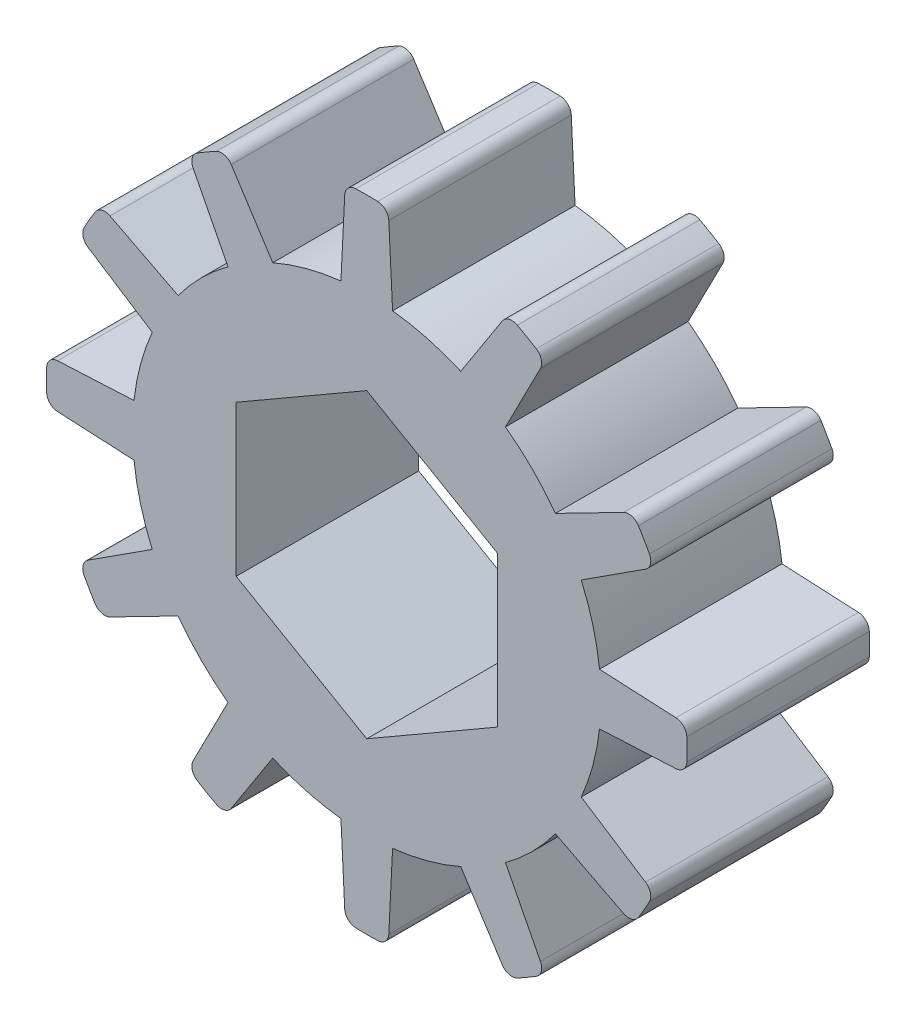
from build123d import *

# Parameters (mm, degrees)
CROQUIS1_R              = 0.5
SALIENTE_EXTRUIR1_DEPTH = 3.18
CORTAR_EXTRUIR3_DEPTH   = 9.508591314
REDONDEO1_R             = 0.2


with BuildPart() as part:
    # Croquis1 → Saliente-Extruir1 (new body)
    with BuildSketch(Plane.XY):
        with BuildLine():
            Line((0.375, 5.567875544), (0.45, 4.055600396))
            ThreePointArc((0.45, 4.055600396), (1.056108396, 3.941450193), (1.638088766, 3.737252971))
            Line((1.638088766, 3.737252971), (2.459178246, 5.009421667))
            ThreePointArc((2.459178246, 5.009421667), (2.790244751, 4.832845674), (3.108697299, 4.634421667))
            Line((3.108697299, 4.634421667), (2.41751163, 3.287252971))
            ThreePointArc((2.41751163, 3.287252971), (2.885341797, 2.885341797), (3.287252971, 2.41751163))
            Line((3.287252971, 2.41751163), (4.634421667, 3.108697299))
            ThreePointArc((4.634421667, 3.108697299), (4.832845674, 2.790244751), (5.009421667, 2.459178246))
            Line((5.009421667, 2.459178246), (3.737252971, 1.638088766))
            ThreePointArc((3.737252971, 1.638088766), (3.941450193, 1.056108396), (4.055600396, 0.45))
            Line((4.055600396, 0.45), (5.567875544, 0.375))
            ThreePointArc((5.567875544, 0.375), (5.580489502, 0), (5.567875544, -0.375))
            Line((5.567875544, -0.375), (4.055600396, -0.45))
            ThreePointArc((4.055600396, -0.45), (3.941450193, -1.056108396), (3.737252971, -1.638088766))
            Line((3.737252971, -1.638088766), (5.009421667, -2.459178246))
            ThreePointArc((5.009421667, -2.459178246), (4.832845674, -2.790244751), (4.634421667, -3.108697299))
            Line((4.634421667, -3.108697299), (3.287252971, -2.41751163))
            ThreePointArc((3.287252971, -2.41751163), (2.885341797, -2.885341797), (2.41751163, -3.287252971))
            Line((2.41751163, -3.287252971), (3.108697299, -4.634421667))
            ThreePointArc((3.108697299, -4.634421667), (2.790244751, -4.832845674), (2.459178246, -5.009421667))
            Line((2.459178246, -5.009421667), (1.638088766, -3.737252971))
            ThreePointArc((1.638088766, -3.737252971), (1.056108396, -3.941450193), (0.45, -4.055600396))
            Line((0.45, -4.055600396), (0.375, -5.567875544))
            ThreePointArc((0.375, -5.567875544), (0, -5.580489502), (-0.375, -5.567875544))
            Line((-0.375, -5.567875544), (-0.45, -4.055600396))
            ThreePointArc((-0.45, -4.055600396), (-1.056108396, -3.941450193), (-1.638088766, -3.737252971))
            Line((-1.638088766, -3.737252971), (-2.459178246, -5.009421667))
            ThreePointArc((-2.459178246, -5.009421667), (-2.790244751, -4.832845674), (-3.108697299, -4.634421667))
            Line((-3.108697299, -4.634421667), (-2.41751163, -3.287252971))
            ThreePointArc((-2.41751163, -3.287252971), (-2.885341797, -2.885341797), (-3.287252971, -2.41751163))
            Line((-3.287252971, -2.41751163), (-4.634421667, -3.108697299))
            ThreePointArc((-4.634421667, -3.108697299), (-4.832845674, -2.790244751), (-5.009421667, -2.459178246))
            Line((-5.009421667, -2.459178246), (-3.737252971, -1.638088766))
            ThreePointArc((-3.737252971, -1.638088766), (-3.941450193, -1.056108396), (-4.055600396, -0.45))
            Line((-4.055600396, -0.45), (-5.567875544, -0.375))
            ThreePointArc((-5.567875544, -0.375), (-5.580489502, 0), (-5.567875544, 0.375))
            Line((-5.567875544, 0.375), (-4.055600396, 0.45))
            ThreePointArc((-4.055600396, 0.45), (-3.941450193, 1.056108396), (-3.737252971, 1.638088766))
            Line((-3.737252971, 1.638088766), (-5.009421667, 2.459178246))
            ThreePointArc((-5.009421667, 2.459178246), (-4.832845674, 2.790244751), (-4.634421667, 3.108697299))
            Line((-4.634421667, 3.108697299), (-3.287252971, 2.41751163))
            ThreePointArc((-3.287252971, 2.41751163), (-2.885341797, 2.885341797), (-2.41751163, 3.287252971))
            Line((-2.41751163, 3.287252971), (-3.108697299, 4.634421667))
            ThreePointArc((-3.108697299, 4.634421667), (-2.790244751, 4.832845674), (-2.459178246, 5.009421667))
            Line((-2.459178246, 5.009421667), (-1.638088766, 3.737252971))
            ThreePointArc((-1.638088766, 3.737252971), (-1.056108396, 3.941450193), (-0.45, 4.055600396))
            Line((-0.45, 4.055600396), (-0.375, 5.567875544))
            ThreePointArc((-0.375, 5.567875544), (0, 5.580489502), (0.375, 5.567875544))
        make_face()
        Circle(CROQUIS1_R, mode=Mode.SUBTRACT)
    extrude(amount=SALIENTE_EXTRUIR1_DEPTH)

    # Croquis10 → Cortar-Extruir3 (cut, through all)
    with BuildSketch(Plane(origin=(0, 0, 0), x_dir=(-1, 0, 0), z_dir=(0, 0, -1))):
        Polygon((0, -2.626943725), (2.275, -1.313471862), (2.275, 1.313471862), (0, 2.626943725), (-2.275, 1.313471862), (-2.275, -1.313471862), align=None)
    extrude(amount=-CORTAR_EXTRUIR3_DEPTH, mode=Mode.SUBTRACT)

    # Redondeo1
    redondeo1_edges = [part.edges().sort_by_distance(p)[0] for p in [
        (5.567875544, -0.375, 1.59),
        (-2.459178246, -5.009421667, 1.59),
        (-3.108697299, -4.634421667, 1.59),
        (0.375, -5.567875544, 1.59),
        (-0.375, -5.567875544, 1.59),
        (3.108697299, -4.634421667, 1.59),
        (2.459178246, -5.009421667, 1.59),
        (5.009421667, -2.459178246, 1.59),
        (4.634421667, -3.108697299, 1.59),
        (-4.634421667, -3.108697299, 1.59),
        (-5.009421667, -2.459178246, 1.59),
        (-5.567875544, -0.375, 1.59),
        (-5.567875544, 0.375, 1.59),
        (-5.009421667, 2.459178246, 1.59),
        (-4.634421667, 3.108697299, 1.59),
        (-3.108697299, 4.634421667, 1.59),
        (-2.459178246, 5.009421667, 1.59),
        (5.567875544, 0.375, 1.59),
        (5.009421667, 2.459178246, 1.59),
        (4.634421667, 3.108697299, 1.59),
        (3.108697299, 4.634421667, 1.59),
        (2.459178246, 5.009421667, 1.59),
        (0.375, 5.567875544, 1.59),
        (-0.375, 5.567875544, 1.59),
    ]]
    fillet(redondeo1_edges, radius=REDONDEO1_R)


solid = part.part
